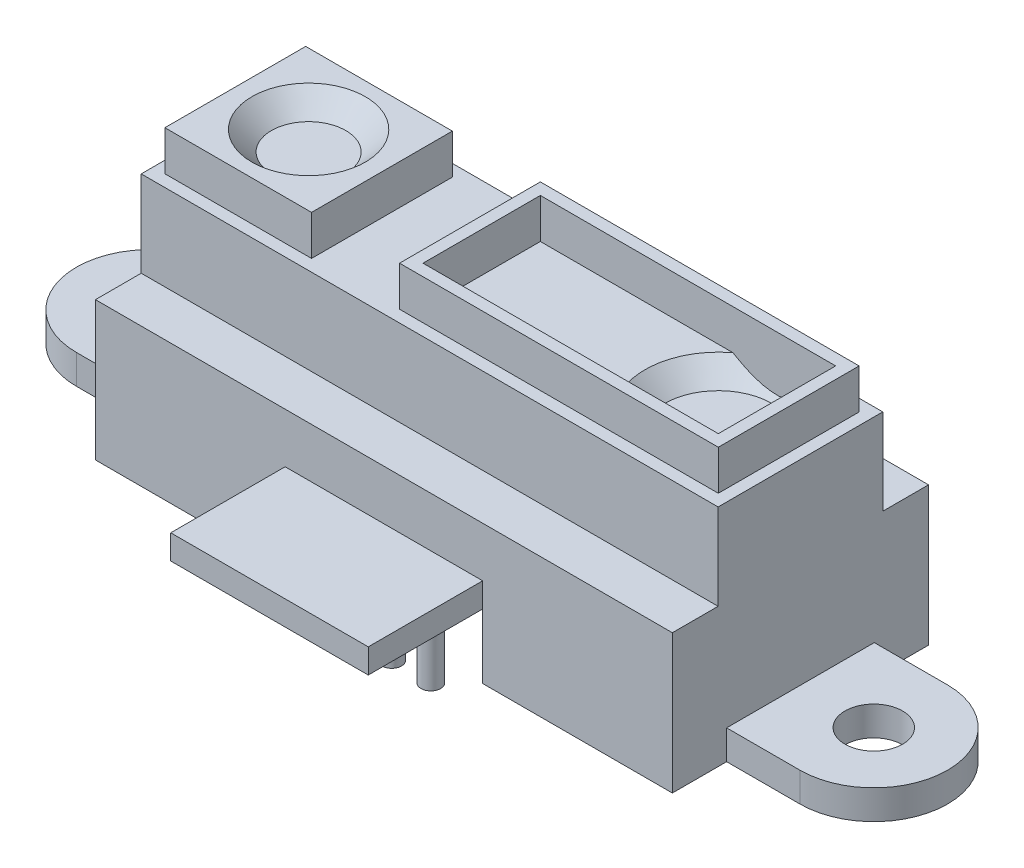
from build123d import *

# Parameters (mm, degrees)
SKETCH1_R             = 1.473596517
BOSS_EXTRUDE1_DEPTH   = 1.5
SKETCH2_W             = 29.5
SKETCH2_H             = 13.1
BOSS_EXTRUDE2_DEPTH   = 5.6
SKETCH3_W             = 29.5
SKETCH3_H             = 8.42
BOSS_EXTRUDE3_DEPTH   = 4.4
SKETCH4_W             = 7.5
SKETCH4_H             = 7.2
SKETCH4_W_2           = 16.3
SKETCH4_W_3           = 15.1
SKETCH4_H_2           = 6
BOSS_EXTRUDE4_DEPTH   = 2.04
SKETCH5_R             = 2.9
CUT_EXTRUDE1_DEPTH    = 1
CUT_EXTRUDE2_DEPTH    = 1
CHAMFER1_SIZE         = 1
SKETCH7_W             = 10.1
SKETCH7_H             = 1.25
BOSS_EXTRUDE5_DEPTH   = 5.85
SKETCH8_W             = 27.9
SKETCH8_H             = 11.5
SKETCH8_W_2           = 10.1
SKETCH8_H_2           = 0.8
CUT_EXTRUDE3_DEPTH    = 3.3
SKETCH9_R             = 0.5
BOSS_EXTRUDE6_DEPTH   = 5
BOSS_EXTRUDE6_2_DEPTH = 5
BOSS_EXTRUDE6_3_DEPTH = 5


with BuildPart() as part:
    # Sketch1 → Boss-Extrude1 (new body)
    with BuildSketch(Plane(origin=(0, 0, 0), x_dir=(1, 0, 0), z_dir=(0, 1, 0))):
        with BuildLine():
            Line((14.75, -6.55), (14.75, -3.775))
            Line((14.75, -3.775), (18.5, -3.775))
            ThreePointArc((18.5, -3.775), (22.275, 0), (18.5, 3.775))
            Line((18.5, 3.775), (14.75, 3.775))
            Line((14.75, 3.775), (14.75, 6.55))
            Line((14.75, 6.55), (-14.75, 6.55))
            Line((-14.75, 6.55), (-14.75, 3.775))
            Line((-14.75, 3.775), (-18.5, 3.775))
            ThreePointArc((-18.5, 3.775), (-22.275, 0), (-18.5, -3.775))
            Line((-18.5, -3.775), (-14.75, -3.775))
            Line((-14.75, -3.775), (-14.75, -6.55))
            Line((-14.75, -6.55), (14.75, -6.55))
        make_face()
        with Locations(Location((-18.5, 0, 0), (0, 0, 270))):
            Circle(SKETCH1_R, mode=Mode.SUBTRACT)
        with Locations(Location((18.5, 0, 0), (0, 0, 270))):
            Circle(SKETCH1_R, mode=Mode.SUBTRACT)
    extrude(amount=BOSS_EXTRUDE1_DEPTH)

    # Sketch2 → Boss-Extrude2 (add)
    with BuildSketch(Plane(origin=(0, 1.5, 0), x_dir=(1, 0, 0), z_dir=(0, 1, 0))):
        Rectangle(SKETCH2_W, SKETCH2_H)
    extrude(amount=BOSS_EXTRUDE2_DEPTH)

    # Sketch3 → Boss-Extrude3 (add)
    with BuildSketch(Plane(origin=(0, 7.1, 0), x_dir=(1, 0, 0), z_dir=(0, 1, 0))):
        Rectangle(SKETCH3_W, SKETCH3_H)
    extrude(amount=BOSS_EXTRUDE3_DEPTH)

    # Sketch4 → Boss-Extrude4 (add)
    # profile 1 of 2: a face of its own
    with BuildSketch(Plane(origin=(0, 11.5, 0), x_dir=(1, 0, 0), z_dir=(0, 1, 0))):
        with Locations((-10.4, 0)):
            Rectangle(SKETCH4_W, SKETCH4_H)
    # profile 2 of 2: a face of its own
    with BuildSketch(Plane(origin=(0, 11.5, 0), x_dir=(1, 0, 0), z_dir=(0, 1, 0))):
        with Locations((6, 0)):
            Rectangle(SKETCH4_W_2, SKETCH4_H)
        with Locations((6, 0)):
            Rectangle(SKETCH4_W_3, SKETCH4_H_2, mode=Mode.SUBTRACT)
    extrude(amount=BOSS_EXTRUDE4_DEPTH)

    # Sketch5 → Cut-Extrude1 (cut)
    with BuildSketch(Plane(origin=(0, 13.54, 0), x_dir=(1, 0, 0), z_dir=(0, 1, 0))):
        with Locations(Location((-10.4, 0, 0), (0, 0, 270))):
            Circle(SKETCH5_R)
    extrude(amount=-CUT_EXTRUDE1_DEPTH, mode=Mode.SUBTRACT)

    # Sketch6 → Cut-Extrude2 (cut)
    with BuildSketch(Plane(origin=(0, 11.5, 0), x_dir=(1, 0, 0), z_dir=(0, 1, 0))):
        with BuildLine():
            ThreePointArc((8.3, 3), (7.195898034, 1.677050983), (6.8, 0))
            Line((6.8, 0), (13.55, 0))
            Line((13.55, 0), (13.55, 2.25))
            ThreePointArc((13.55, 2.25), (13.201650429, 2.651650429), (12.8, 3))
            Line((12.8, 3), (8.3, 3))
        make_face()
        with BuildLine():
            Line((13.55, 0), (6.8, 0))
            ThreePointArc((6.8, 0), (7.195898034, -1.677050983), (8.3, -3))
            Line((8.3, -3), (12.8, -3))
            ThreePointArc((12.8, -3), (13.201650429, -2.651650429), (13.55, -2.25))
            Line((13.55, -2.25), (13.55, 0))
        make_face()
    extrude(amount=-CUT_EXTRUDE2_DEPTH, mode=Mode.SUBTRACT)

    # Chamfer1
    # the kernel refuses this chamfer: 1 mm, written as the material it adds along each edge
    with BuildSketch(Plane(origin=(-10.4, 12.54, 0), x_dir=(0, 0, 1), z_dir=(-1, 0, 0))) as chamfer1_piece_1_section:
        Polygon((2.9, CHAMFER1_SIZE), (2.9 - CHAMFER1_SIZE, 0), (2.9, 0), align=None)
    chamfer1_piece_1 = revolve(axis=Axis((-10.4, 12.54, 0), (0, 1, 0)), mode=Mode.PRIVATE)
    chamfer1_piece_1 = split(chamfer1_piece_1, bisect_by=Plane(origin=(-10.4, 13.54, -2.40049425), z_dir=(0, -1, 0)), keep=Keep.TOP, mode=Mode.PRIVATE)
    add(chamfer1_piece_1)
    with BuildSketch(Plane(origin=(10.55, 10.5, 0), x_dir=(0.04265214044718796, 0, -0.9990899833925238), z_dir=(0.9990899833925238, 0, 0.04265214044718796))) as chamfer1_piece_2_section:
        Polygon((3.75 - CHAMFER1_SIZE, 0), (3.75, CHAMFER1_SIZE), (3.75, 0), align=None)
    chamfer1_piece_2 = revolve(axis=Axis((10.55, 10.5, 0), (0, 1, 0)), revolution_arc=184.889058401, mode=Mode.PRIVATE)
    chamfer1_piece_2 = split(chamfer1_piece_2, bisect_by=Plane(origin=(7.302801052, 11.5, 0), z_dir=(0, -1, 0)), keep=Keep.TOP, mode=Mode.PRIVATE)
    add(chamfer1_piece_2)
    with BuildSketch(Plane(origin=(10.55, 10.5, 0), x_dir=(0.999105910747441, 0, 0.04227740660833228), z_dir=(-0.04227740660833228, 0, 0.999105910747441))) as chamfer1_piece_3_section:
        Polygon((3.75, CHAMFER1_SIZE), (3.75 - CHAMFER1_SIZE, 0), (3.75, 0), align=None)
    chamfer1_piece_3 = revolve(axis=Axis((10.55, 10.5, 0), (0, 1, 0)), revolution_arc=94.846078296, mode=Mode.PRIVATE)
    chamfer1_piece_3 = split(chamfer1_piece_3, bisect_by=Plane(origin=(13.908005582, 11.5, -0.857414342), z_dir=(0, -1, 0)), keep=Keep.TOP, mode=Mode.PRIVATE)
    add(chamfer1_piece_3)
    with BuildSketch(Plane(origin=(10.55, 10.5, 0), x_dir=(-0.04227740660831898, 0, 0.9991059107474417), z_dir=(-0.9991059107474417, 0, -0.04227740660831898))) as chamfer1_piece_4_section:
        Polygon((3.75, CHAMFER1_SIZE), (3.75 - CHAMFER1_SIZE, 0), (3.75, 0), align=None)
    chamfer1_piece_4 = revolve(axis=Axis((10.55, 10.5, 0), (0, 1, 0)), revolution_arc=94.846078296, mode=Mode.PRIVATE)
    chamfer1_piece_4 = split(chamfer1_piece_4, bisect_by=Plane(origin=(11.407414343, 11.5, 3.358005582), z_dir=(0, -1, 0)), keep=Keep.TOP, mode=Mode.PRIVATE)
    add(chamfer1_piece_4)

    # Sketch7 → Boss-Extrude5 (add)
    with BuildSketch(Plane.XY.offset(6.55)):
        with Locations((0, 3.925)):
            Rectangle(SKETCH7_W, SKETCH7_H)
    extrude(amount=BOSS_EXTRUDE5_DEPTH)

    # Sketch8 → Cut-Extrude3 (cut)
    with BuildSketch(Plane.XZ):
        Rectangle(SKETCH8_W, SKETCH8_H)
        with Locations((0, 6.15)):
            Rectangle(SKETCH8_W_2, SKETCH8_H_2)
    extrude(amount=-CUT_EXTRUDE3_DEPTH, mode=Mode.SUBTRACT)


with BuildPart() as body_2:
    # Sketch9 → Boss-Extrude6 (new body)
    with BuildSketch(Plane.XZ.offset(-3.3)):
        with Locations(Location((0, 6.15, 0), (0, 0, 270))):
            Circle(SKETCH9_R)
    extrude(amount=BOSS_EXTRUDE6_DEPTH)


with BuildPart() as body_3:
    # Sketch9 → Boss-Extrude6 2 (new body)
    with BuildSketch(Plane.XZ.offset(-3.3)):
        with Locations(Location((-2, 6.15, 0), (0, 0, 270))):
            Circle(SKETCH9_R)
    extrude(amount=BOSS_EXTRUDE6_2_DEPTH)


with BuildPart() as body_4:
    # Sketch9 → Boss-Extrude6 3 (new body)
    with BuildSketch(Plane.XZ.offset(-3.3)):
        with Locations(Location((2, 6.15, 0), (0, 0, 90))):
            Circle(SKETCH9_R)
    extrude(amount=BOSS_EXTRUDE6_3_DEPTH)


solid = Compound([part.part, body_2.part, body_3.part, body_4.part])
